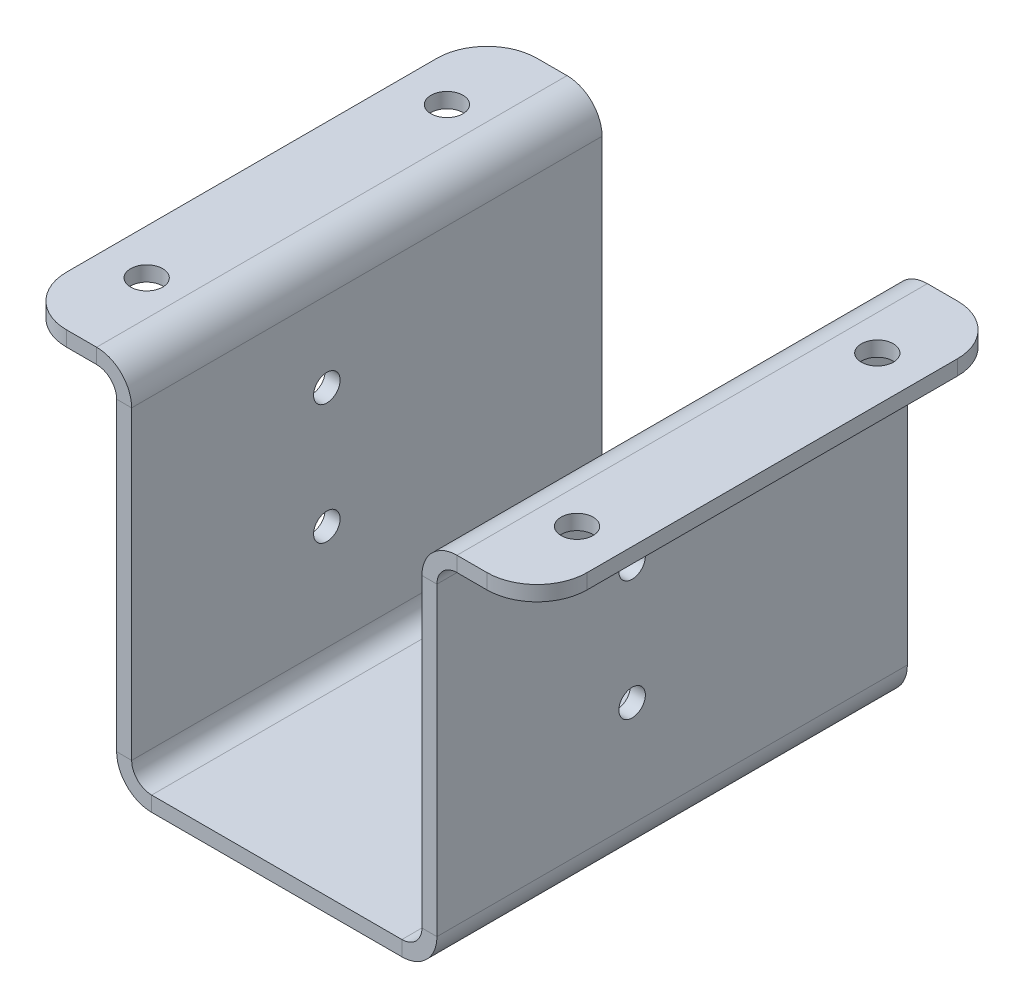
from build123d import *

# Parameters (mm, degrees)
SKETCH1_W                    = 29
SKETCH1_H                    = 47
BASE_FLANGE1_DEPTH           = 1.5
EDGE_FLANGE1_STRIP_W         = 10
EDGE_FLANGE1_STRIP_H         = 1.5
EDGE_FLANGE1_STRIP_CUT_DEPTH = 47
EDGE_FLANGE1_DEPTH           = 47
EDGE_FLANGE2_STRIP_W         = 10
EDGE_FLANGE2_STRIP_H         = 1.5
EDGE_FLANGE2_STRIP_CUT_DEPTH = 47
EDGE_FLANGE2_DEPTH           = 47
SKETCH12_R                   = 1.6
CUT_EXTRUDE1_DEPTH           = 10
SKETCH13_R                   = 1.325
CUT_EXTRUDE2_DEPTH           = 62.012293843
FILLET1_R                    = 5


# Sheet-metal steps are written as plain solids
with BuildPart() as part:
    # Sketch1 → Base-Flange1 (new body)
    with BuildSketch(Plane(origin=(0, 0, 0), x_dir=(1, 0, 0), z_dir=(0, 1, 0))):
        Rectangle(SKETCH1_W, SKETCH1_H)
    extrude(amount=BASE_FLANGE1_DEPTH)

    # Edge-Flange1 strip (across the edge) → Edge-Flange1 strip cut (cut)
    with BuildSketch(Plane(origin=(14.5, 1.5, 23.5), x_dir=(-1, 0, 0), z_dir=(0, 0, -1))):
        with Locations((-3, -0.75)):
            Rectangle(EDGE_FLANGE1_STRIP_W, EDGE_FLANGE1_STRIP_H)
    edge_flange1_strip_cut = extrude(amount=EDGE_FLANGE1_STRIP_CUT_DEPTH, mode=Mode.SUBTRACT)

    # Edge-Flange1 section (across the edge) → Edge-Flange1 (add)
    with BuildSketch(Plane(origin=(14.5, 1.5, 23.5), x_dir=(-1, 0, 0), z_dir=(0, 0, -1))):
        with BuildLine():
            Line((-1.5, 2), (-1.5, 36))
            Line((-1.5, 36), (0, 36))
            Line((0, 36), (0, 2))
            ThreePointArc((0, 2), (0.585786438, 0.585786438), (2, 0))
            Line((2, 0), (2, -1.5))
            ThreePointArc((2, -1.5), (-0.474873734, -0.474873734), (-1.5, 2))
        make_face()
    edge_flange1 = extrude(amount=EDGE_FLANGE1_DEPTH)

    # Mirror1: Edge-Flange1 strip cut, Edge-Flange1 across plane
    add(edge_flange1_strip_cut.mirror(Plane(origin=(0, 0, 0), x_dir=(0, 0, 1), z_dir=(1, 0, 0))), mode=Mode.SUBTRACT)
    add(edge_flange1.mirror(Plane(origin=(0, 0, 0), x_dir=(0, 0, 1), z_dir=(1, 0, 0))))

    # Edge-Flange2 strip (across the edge) → Edge-Flange2 strip cut (cut)
    with BuildSketch(Plane(origin=(-16, 37.5, 23.5), x_dir=(0, -1, 0), z_dir=(0, 0, -1))):
        with Locations((-1.5, -0.75)):
            Rectangle(EDGE_FLANGE2_STRIP_W, EDGE_FLANGE2_STRIP_H)
    edge_flange2_strip_cut = extrude(amount=EDGE_FLANGE2_STRIP_CUT_DEPTH, mode=Mode.SUBTRACT)

    # Edge-Flange2 section (across the edge) → Edge-Flange2 (add)
    with BuildSketch(Plane(origin=(-16, 37.5, 23.5), x_dir=(0, -1, 0), z_dir=(0, 0, -1))):
        with BuildLine():
            Line((0, 2), (0, 10))
            Line((0, 10), (1.5, 10))
            Line((1.5, 10), (1.5, 2))
            ThreePointArc((1.5, 2), (2.085786438, 0.585786438), (3.5, 0))
            Line((3.5, 0), (3.5, -1.5))
            ThreePointArc((3.5, -1.5), (1.025126266, -0.474873734), (0, 2))
        make_face()
    edge_flange2 = extrude(amount=EDGE_FLANGE2_DEPTH)

    # Mirror2: Edge-Flange2 strip cut, Edge-Flange2 across plane
    add(edge_flange2_strip_cut.mirror(Plane(origin=(0, 0, 0), x_dir=(0, 0, 1), z_dir=(1, 0, 0))), mode=Mode.SUBTRACT)
    add(edge_flange2.mirror(Plane(origin=(0, 0, 0), x_dir=(0, 0, 1), z_dir=(1, 0, 0))))

    # Sketch12 → Cut-Extrude1 (cut)
    with BuildSketch(Plane(origin=(0, 37.5, 0), x_dir=(1, 0, 0), z_dir=(0, 1, 0))):
        with Locations(Location((21.5, 15, 0), (0, 0, 270))):
            Circle(SKETCH12_R)
        with Locations(Location((-21.5, 15, 0), (0, 0, 270))):
            Circle(SKETCH12_R)
        with Locations(Location((-21.5, -15, 0), (0, 0, 270))):
            Circle(SKETCH12_R)
        with Locations(Location((21.5, -15, 0), (0, 0, 270))):
            Circle(SKETCH12_R)
    extrude(amount=-CUT_EXTRUDE1_DEPTH, mode=Mode.SUBTRACT)

    # Sketch13 → Cut-Extrude2 (cut, through all)
    with BuildSketch(Plane(origin=(16, 0, 0), x_dir=(0, 0, -1), z_dir=(1, 0, 0))):
        with Locations(Location((-4, 26, 0), (0, 0, 270))):
            Circle(SKETCH13_R)
        with Locations(Location((-4, 14, 0), (0, 0, 270))):
            Circle(SKETCH13_R)
    extrude(amount=-CUT_EXTRUDE2_DEPTH, mode=Mode.SUBTRACT)

    # Fillet1
    fillet1_edges = [part.edges().sort_by_distance(p)[0] for p in [
        (-26, 36.75, 23.5),
        (-26, 36.75, -23.5),
        (26, 36.75, -23.5),
        (26, 36.75, 23.5),
    ]]
    fillet(fillet1_edges, radius=FILLET1_R)


solid = part.part
